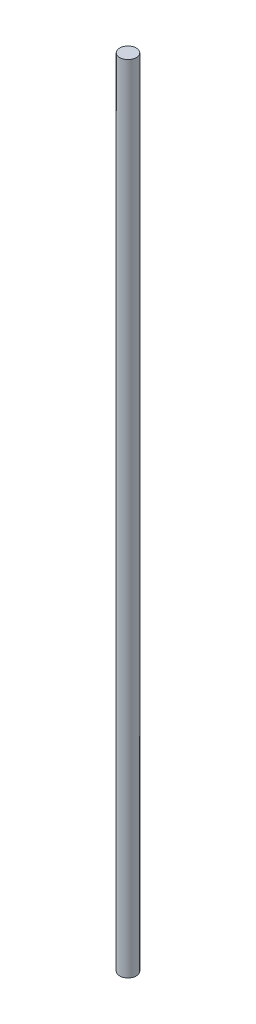
from build123d import *

# Parameters (mm, degrees)
SKETCH1_R           = 6.35
BOSS_EXTRUDE1_DEPTH = 303.276


with BuildPart() as part:
    # Sketch1 → Boss-Extrude1 (new, symmetric)
    with BuildSketch(Plane(origin=(0, 0, 0), x_dir=(1, 0, 0), z_dir=(0, 1, 0))):
        Circle(SKETCH1_R)
    extrude(amount=BOSS_EXTRUDE1_DEPTH, both=True)


solid = part.part
